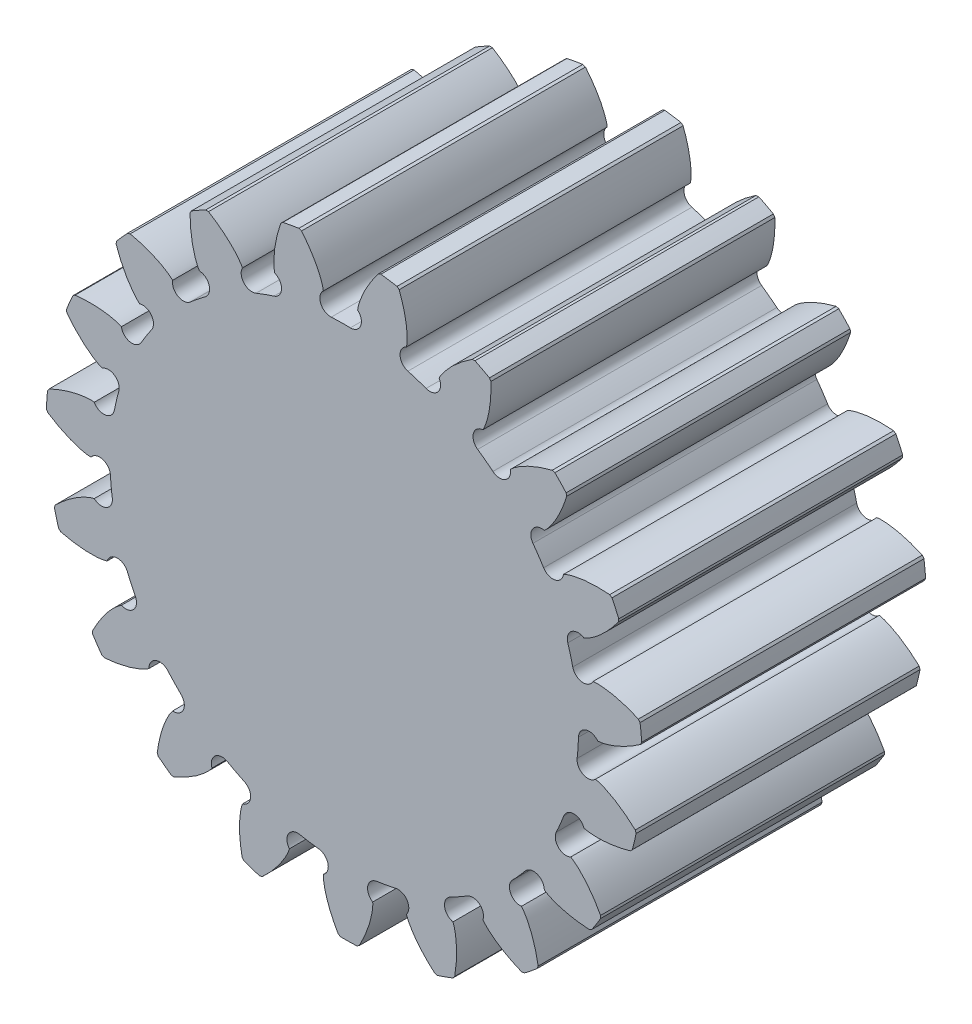
from build123d import *

# Parameters (mm, degrees)
SKETCH1_R                    = 28.875
BOSS_EXTRUDE1_DEPTH          = 35
BOSS_EXTRUDE2_DEPTH          = 35
CHAMFER1_SIZE                = 0.2
CIRPATTERN1_COUNT            = 19
CHAMFER1_OF_CIRPATTERN1_SIZE = 0.2


with BuildPart() as part:
    # Sketch1 → Boss-Extrude1 (new body)
    with BuildSketch(Plane.XY):
        Circle(SKETCH1_R)
    extrude(amount=BOSS_EXTRUDE1_DEPTH)

    # Sketch3 → Boss-Extrude2 (add)
    with BuildSketch(Plane.XY):
        with BuildLine():
            ThreePointArc((28.864479303, -0.779396924), (28.73764311, 2.813093226), (28.165418059, 6.361984798))
            ThreePointArc((28.165418059, 6.361984798), (29.301832858, 5.334790357), (30.651694421, 6.058973192))
            add(Edge.make_bspline(
                [(30.651694421, 6.058973192), (30.662830769, 6.061003658), (30.694157456, 6.066187651), (30.75373315, 6.073968277), (30.851369179, 6.083783427), (30.976337254, 6.092048459), (31.138398044, 6.097849162), (31.32989494, 6.09839668), (31.540825773, 6.092405353), (31.770689591, 6.078769713), (32.000240704, 6.05887118), (32.229340043, 6.033165614), (32.457593297, 6.002278035), (32.734011719, 5.958631448), (33.065297471, 5.897633737), (33.451986017, 5.813752013), (33.889698233, 5.703786788), (34.334485196, 5.575929467), (34.770942629, 5.437165618), (35.210138343, 5.282165958), (35.633790492, 5.121712282), (36.005119395, 4.967589035), (36.250394473, 4.861905211), (36.39659585, 4.796457921), (36.438115272, 4.777683063)],
                knots=[0, 0, 0, 0, 0, 0.005376749, 0.015083688, 0.02853182, 0.04661014, 0.064854849, 0.092110525, 0.119476176, 0.146842496, 0.174208854, 0.201574956, 0.228941013, 0.256307345, 0.307035032, 0.361767352, 0.416499661, 0.471231937, 0.525964282, 0.580696616, 0.635428982, 0.690161387, 0.711677785, 0.711677785, 0.711677785, 0.711677785, 0.711677785], degree=4))
            ThreePointArc((36.438115272, 4.777683063), (36.57518214, 3.58030047), (36.672912875, 2.37906731))
            add(Edge.make_bspline(
                [(31.2448, 0), (31.256118699, 0.000167632), (31.287856002, 0.001156896), (31.347809613, 0.00507685), (31.44549561, 0.014381537), (31.569694225, 0.030507132), (31.729803559, 0.056243274), (31.917771532, 0.092841114), (32.123536528, 0.139622294), (32.346392731, 0.197574151), (32.567727671, 0.261609376), (32.787493314, 0.331253793), (33.005424042, 0.405817784), (33.26813142, 0.502238745), (33.581299888, 0.626321303), (33.94438181, 0.783597154), (34.352460746, 0.976355855), (34.764010508, 1.188038945), (35.165273867, 1.408806272), (35.566075089, 1.646032219), (35.950570164, 1.885594452), (36.284962813, 2.108799931), (36.505087803, 2.260041206), (36.635822406, 2.352597425), (36.672912875, 2.37906731)],
                knots=[0, 0, 0, 0, 0, 0.005376749, 0.015083688, 0.02853182, 0.04661014, 0.064854849, 0.092110525, 0.119476176, 0.146842496, 0.174208854, 0.201574956, 0.228941013, 0.256307345, 0.307035032, 0.361767352, 0.416499661, 0.471231937, 0.525964282, 0.580696616, 0.635428982, 0.690161387, 0.711677785, 0.711677785, 0.711677785, 0.711677785, 0.711677785], degree=4))
            ThreePointArc((31.2448, 0), (29.780129126, 0.448671649), (28.864479303, -0.779396924))
        make_face()
    boss_extrude2 = extrude(amount=BOSS_EXTRUDE2_DEPTH)

    # Chamfer1
    chamfer1_edges = [part.edges().sort_by_distance(p)[0] for p in [
        (36.438115272, 4.777683063, 17.5),
        (36.672912875, 2.37906731, 17.5),
    ]]
    chamfer(chamfer1_edges, length=CHAMFER1_SIZE - 0.0004)  # a hair under: the kernel refuses the full size

    # CirPattern1: Boss-Extrude2 ×19 about axis
    cirpattern1_axis = Axis((0, 0, 35), (0, 0, -1))
    for i in range(1, CIRPATTERN1_COUNT):
        add(boss_extrude2.rotate(cirpattern1_axis, i * 360 / CIRPATTERN1_COUNT))

    # Chamfer1 of CirPattern1
    chamfer1_of_cirpattern1_edges = [part.edges().sort_by_distance(p)[0] for p in [
        (36.015108834, -7.312621671, 17.5),
        (35.458355193, -9.657512463, 17.5),
        (31.689306522, -18.61049038, 17.5),
        (30.401334533, -20.64755091, 17.5),
        (23.929476138, -27.891623685, 17.5),
        (22.049857552, -29.400106836, 17.5),
        (13.57651571, -34.15026678, 17.5),
        (11.308936365, -34.966704996, 17.5),
        (1.752329144, -36.708198574, 17.5),
        (-0.657483553, -36.744118106, 17.5),
        (-10.261749475, -35.288227466, 17.5),
        (-12.552654926, -34.539735875, 17.5),
        (-21.163808311, -30.044229359, 17.5),
        (-23.087551363, -28.592437323, 17.5),
        (-29.772440126, -21.544472816, 17.5),
        (-31.12055337, -19.54670453, 17.5),
        (-35.154766087, -10.710038347, 17.5),
        (-35.781160534, -8.382783002, 17.5),
        (-36.727527659, 1.28499496, 17.5),
        (-36.564323752, 3.689543136, 17.5),
        (-34.320291724, 13.140779125, 17.5),
        (-33.385175138, 15.362050026, 17.5),
        (-28.193919646, 23.572555971, 17.5),
        (-26.588224773, 25.369840429, 17.5),
        (-19.0122989, 31.449880612, 17.5),
        (-16.910027696, 32.628414968, 17.5),
        (-7.770400563, 35.919122694, 17.5),
        (-5.399366731, 36.351194463, 17.5),
        (4.313541246, 36.495970489, 17.5),
        (6.696399399, 36.134757991, 17.5),
        (15.930043929, 33.117913588, 17.5),
        (18.066506748, 32.002559803, 17.5),
        (25.820279172, 26.151016873, 17.5),
        (27.478827761, 24.402387688, 17.5),
        (32.912486524, 16.350251704, 17.5),
        (33.913391408, 14.157838226, 17.5),
    ]]
    chamfer(chamfer1_of_cirpattern1_edges, length=CHAMFER1_OF_CIRPATTERN1_SIZE - 0.0004)  # a hair under: the kernel refuses the full size


solid = part.part
